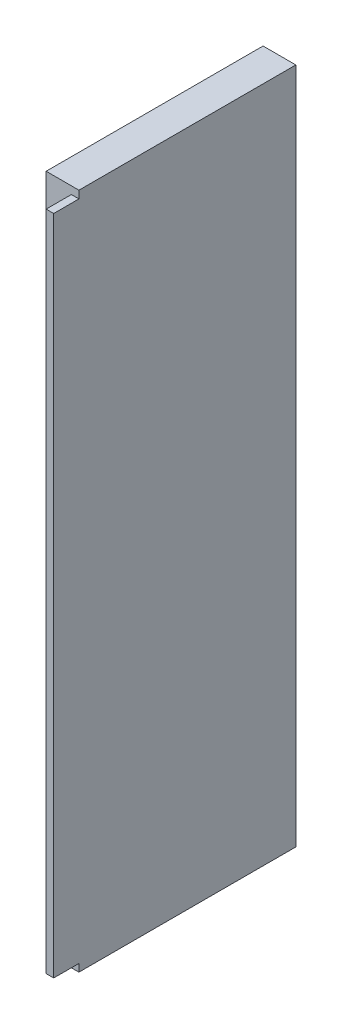
from build123d import *

# Parameters (mm, degrees)
BOSS_EXTRUDE1_DEPTH = 105
SKETCH2_W           = 5.2
SKETCH2_H           = 34.4
BOSS_EXTRUDE2_DEPTH = 1.2
SKETCH3_W           = 5.2
SKETCH3_H           = 34.4
BOSS_EXTRUDE3_DEPTH = 1.2
CUT_EXTRUDE1_REACH  = 110.369
SKETCH4_W           = 3
SKETCH4_H           = 3


with BuildPart() as part:
    # Sketch1 → Boss-Extrude1 (new body)
    with BuildSketch(Plane(origin=(0, 0, 0), x_dir=(1, 0, 0), z_dir=(0, 1, 0))):
        Polygon((0, -16), (0, 16), (-4, 16), (-4, 17.2), (1.2, 17.2), (1.2, -17.2), (1.2, -21.2), (0, -21.2), (0, -17.2), (-4, -17.2), (-4, -16), align=None)
    extrude(amount=BOSS_EXTRUDE1_DEPTH)

    # Sketch2 → Boss-Extrude2 (add)
    with BuildSketch(Plane(origin=(0, 105, 0), x_dir=(1, 0, 0), z_dir=(0, 1, 0))):
        with Locations((-1.4, 0)):
            Rectangle(SKETCH2_W, SKETCH2_H)
    extrude(amount=BOSS_EXTRUDE2_DEPTH)

    # Sketch3 → Boss-Extrude3 (add)
    with BuildSketch(Plane.XZ):
        with Locations((-1.4, 0)):
            Rectangle(SKETCH3_W, SKETCH3_H)
    extrude(amount=BOSS_EXTRUDE3_DEPTH)

    # Sketch4 → Cut-Extrude1 (cut, up to next)
    with BuildSketch(Plane(origin=(0, 0, 0), x_dir=(1, 0, 0), z_dir=(0, 1, 0)), mode=Mode.PRIVATE) as cut_extrude1_sk1:
        with Locations((-1.5, -11)):
            Rectangle(SKETCH4_W, SKETCH4_H)
    cut_extrude1_tool1 = extrude(cut_extrude1_sk1.sketch, amount=-CUT_EXTRUDE1_REACH, mode=Mode.PRIVATE) & part.part
    # Sketch4 → Cut-Extrude1 (cut, up to next)
    with BuildSketch(Plane(origin=(0, 0, 0), x_dir=(1, 0, 0), z_dir=(0, 1, 0)), mode=Mode.PRIVATE) as cut_extrude1_sk2:
        with Locations((-1.5, -3.666666667)):
            Rectangle(SKETCH4_W, SKETCH4_H)
    cut_extrude1_tool2 = extrude(cut_extrude1_sk2.sketch, amount=-CUT_EXTRUDE1_REACH, mode=Mode.PRIVATE) & part.part
    # Sketch4 → Cut-Extrude1 (cut, up to next)
    with BuildSketch(Plane(origin=(0, 0, 0), x_dir=(1, 0, 0), z_dir=(0, 1, 0)), mode=Mode.PRIVATE) as cut_extrude1_sk3:
        with Locations((-1.5, 3.666666667)):
            Rectangle(SKETCH4_W, SKETCH4_H)
    cut_extrude1_tool3 = extrude(cut_extrude1_sk3.sketch, amount=-CUT_EXTRUDE1_REACH, mode=Mode.PRIVATE) & part.part
    # Sketch4 → Cut-Extrude1 (cut, up to next)
    with BuildSketch(Plane(origin=(0, 0, 0), x_dir=(1, 0, 0), z_dir=(0, 1, 0)), mode=Mode.PRIVATE) as cut_extrude1_sk4:
        with Locations((-1.5, 11)):
            Rectangle(SKETCH4_W, SKETCH4_H)
    cut_extrude1_tool4 = extrude(cut_extrude1_sk4.sketch, amount=-CUT_EXTRUDE1_REACH, mode=Mode.PRIVATE) & part.part
    add(cut_extrude1_tool1.solids().sort_by_distance((-1.5, 0, 11))[0], mode=Mode.SUBTRACT)
    add(cut_extrude1_tool2.solids().sort_by_distance((-1.5, 0, 3.666667))[0], mode=Mode.SUBTRACT)
    add(cut_extrude1_tool3.solids().sort_by_distance((-1.5, 0, -3.666667))[0], mode=Mode.SUBTRACT)
    add(cut_extrude1_tool4.solids().sort_by_distance((-1.5, 0, -11))[0], mode=Mode.SUBTRACT)


solid = part.part
